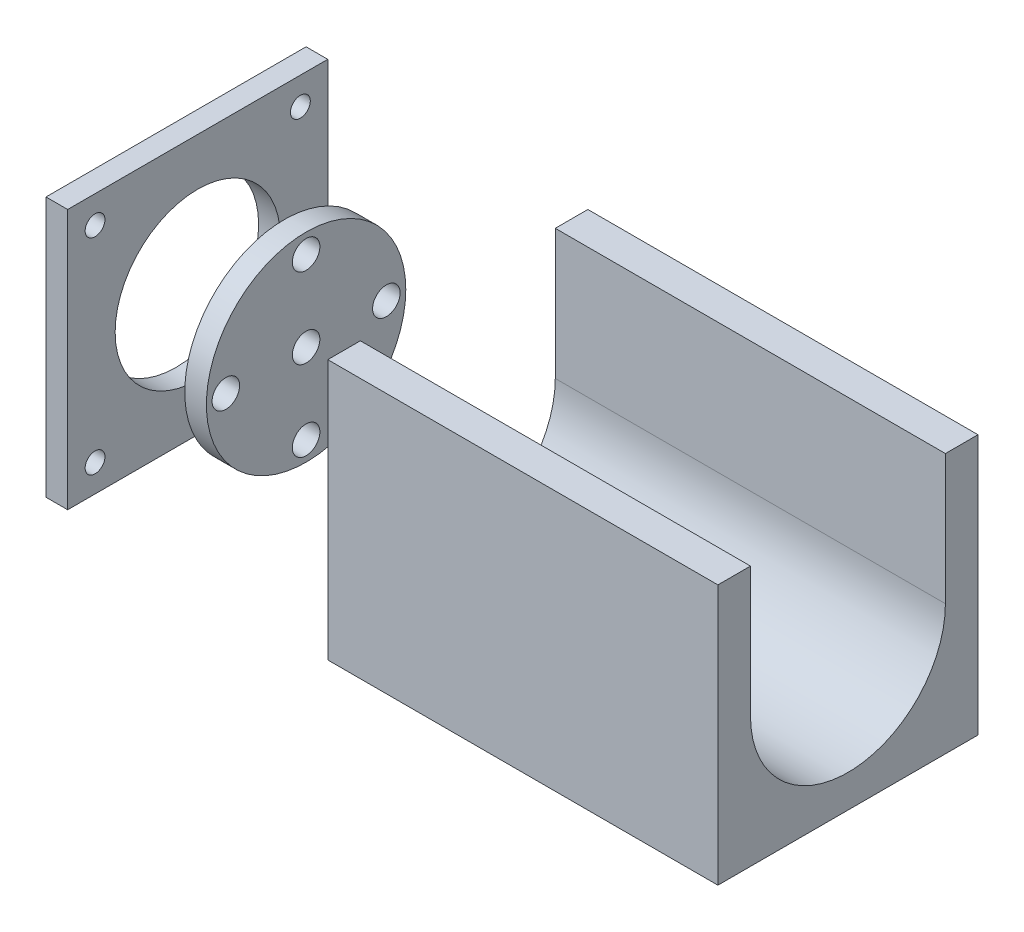
from build123d import *

# Parameters (mm, degrees)
SKETCH1_W           = 60
SKETCH1_H           = 60
SKETCH1_R           = 2.286
SKETCH1_R_2         = 19.05
BOSS_EXTRUDE1_DEPTH = 5
SKETCH2_R           = 23
SKETCH2_R_2         = 3.175
BOSS_EXTRUDE2_DEPTH = 5
BOSS_EXTRUDE3_DEPTH = 90


with BuildPart() as part:
    # Sketch1 → Boss-Extrude1 (new body)
    with BuildSketch(Plane(origin=(0, 0, 0), x_dir=(0, 0, -1), z_dir=(1, 0, 0))):
        Rectangle(SKETCH1_W, SKETCH1_H)
        with Locations((-23.6855, 23.6855)):
            Circle(SKETCH1_R, mode=Mode.SUBTRACT)
        with Locations((23.6855, 23.6855)):
            Circle(SKETCH1_R, mode=Mode.SUBTRACT)
        with Locations((-23.6855, -23.6855)):
            Circle(SKETCH1_R, mode=Mode.SUBTRACT)
        with Locations((23.6855, -23.6855)):
            Circle(SKETCH1_R, mode=Mode.SUBTRACT)
        Circle(SKETCH1_R_2, mode=Mode.SUBTRACT)
    extrude(amount=BOSS_EXTRUDE1_DEPTH)


with BuildPart() as body_2:
    # Sketch2 → Boss-Extrude2 (new body)
    with BuildSketch(Plane(origin=(25, 0, 0), x_dir=(0, 0, -1), z_dir=(1, 0, 0))):
        Circle(SKETCH2_R)
        Circle(SKETCH2_R_2, mode=Mode.SUBTRACT)
        with Locations((0, 18.5125)):
            Circle(SKETCH2_R_2, mode=Mode.SUBTRACT)
        with Locations((-18.5125, 0)):
            Circle(SKETCH2_R_2, mode=Mode.SUBTRACT)
        with Locations((0, -18.5125)):
            Circle(SKETCH2_R_2, mode=Mode.SUBTRACT)
        with Locations((18.5125, 0)):
            Circle(SKETCH2_R_2, mode=Mode.SUBTRACT)
    extrude(amount=BOSS_EXTRUDE2_DEPTH)


with BuildPart() as body_3:
    # Sketch3 → Boss-Extrude3 (new body)
    with BuildSketch(Plane(origin=(65, 0, 0), x_dir=(0, 0, -1), z_dir=(1, 0, 0))):
        with BuildLine():
            Line((-22.48125, 0), (-22.48125, 30))
            Line((-22.48125, 30), (-30, 30))
            Line((-30, 30), (-30, -30))
            Line((-30, -30), (30, -30))
            Line((30, -30), (30, 30))
            Line((30, 30), (22.48125, 30))
            Line((22.48125, 30), (22.48125, 0))
            ThreePointArc((22.48125, 0), (0, -22.48125), (-22.48125, 0))
        make_face()
    extrude(amount=BOSS_EXTRUDE3_DEPTH)


solid = Compound([part.part, body_2.part, body_3.part])
